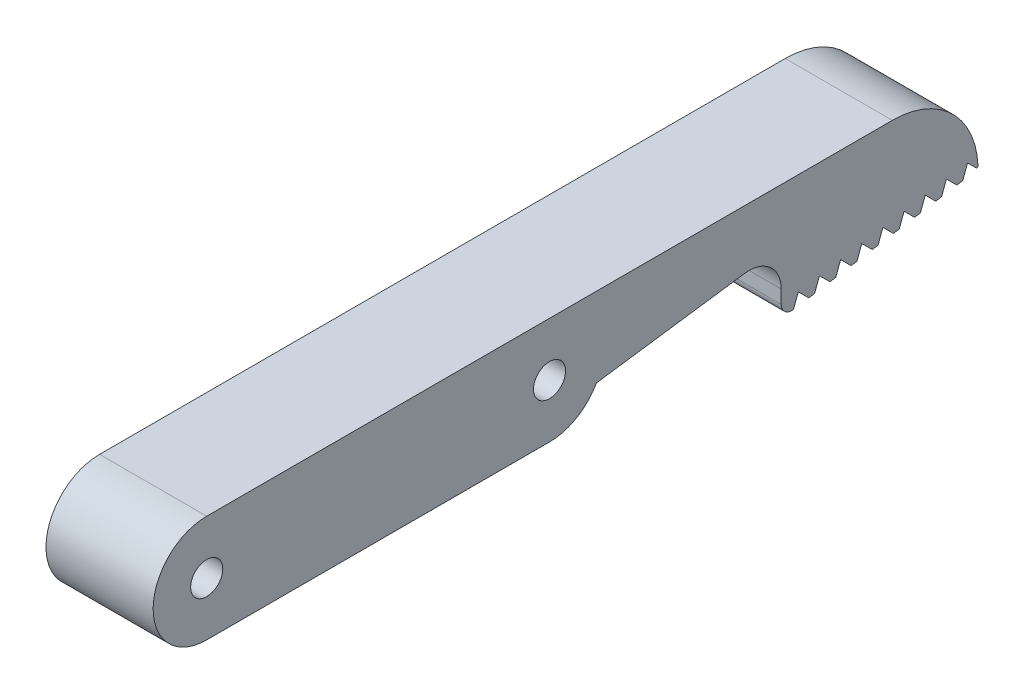
from build123d import *

# Parameters (mm, degrees)
SKETCH1_R           = 5
SKETCH1_R_2         = 1.5
BOSS_EXTRUDE1_DEPTH = 5
BOSS_EXTRUDE4_DEPTH = 10
FILLET5_R           = 3
FILLET7_R           = 8
CUT_EXTRUDE6_DEPTH  = 10
FILLET9_R           = 1
FILLET11_R          = 0.1


with BuildPart() as part:
    # Sketch1 → Boss-Extrude1 (new, symmetric)
    # profile 1 of 3: a face of its own
    with BuildSketch(Plane(origin=(0, 0, 0), x_dir=(0, 0, -1), z_dir=(1, 0, 0))):
        with BuildLine():
            ThreePointArc((-11, 0), (-12.464466094, -3.535533906), (-16, -5))
            Line((-16, -5), (16, -5))
            ThreePointArc((16, -5), (11, 0), (16, 5))
            Line((16, 5), (-16, 5))
            ThreePointArc((-16, 5), (-12.464466094, 3.535533906), (-11, 0))
        make_face()
    # profile 2 of 3: a face of its own
    with BuildSketch(Plane(origin=(0, 0, 0), x_dir=(0, 0, -1), z_dir=(1, 0, 0))):
        with Locations((-16, 0)):
            Circle(SKETCH1_R)
        with Locations((-16, 0)):
            Circle(SKETCH1_R_2, mode=Mode.SUBTRACT)
    # profile 3 of 3: a face of its own
    with BuildSketch(Plane(origin=(0, 0, 0), x_dir=(0, 0, -1), z_dir=(1, 0, 0))):
        with Locations((16, 0)):
            Circle(SKETCH1_R)
        with Locations((16, 0)):
            Circle(SKETCH1_R_2, mode=Mode.SUBTRACT)
    extrude(amount=BOSS_EXTRUDE1_DEPTH, both=True)

    # Sketch6 → Boss-Extrude4 (add)
    with BuildSketch(Plane(origin=(5, 0, 0), x_dir=(0, 0, -1), z_dir=(1, 0, 0))):
        with BuildLine():
            Line((20.375428035, -2.419840804), (37.626356882, 0))
            Line((37.626356882, 0), (37.626356882, -5.863506349))
            Line((37.626356882, -5.863506349), (56, -2.931753174))
            Line((56, -2.931753174), (56, -0.788607304))
            Line((56, -0.788607304), (56, 5))
            Line((56, 5), (16, 5))
            ThreePointArc((16, 5), (20.30692489, 2.539763373), (20.375428035, -2.419840804))
        make_face()
    extrude(amount=-BOSS_EXTRUDE4_DEPTH)

    # Fillet5
    fillet5_edges = [part.edges().sort_by_distance(p)[0] for p in [
        (0, 0, -37.626356882),
    ]]
    fillet(fillet5_edges, radius=FILLET5_R)

    # Fillet7
    # the kernel refuses this fillet: 8 mm, written as the material it takes off along each edge
    with BuildSketch(Plane(origin=(25, 5, -56), x_dir=(0, -1, 0), z_dir=(-1, 0, 0))) as fillet7_piece_1:
        with BuildLine():
            CenterArc((FILLET7_R, FILLET7_R), FILLET7_R, 180, 90)
            Line((0, FILLET7_R), (0, 0))
            Line((0, 0), (FILLET7_R, 0))
        make_face()
    extrude(amount=50, mode=Mode.SUBTRACT)

    # Sketch8 → Cut-Extrude6 (cut)
    with BuildSketch(Plane(origin=(5, 0, 0), x_dir=(0, 0, -1), z_dir=(1, 0, 0))):
        Polygon((56, -2.931753174), (55.020132037, -1.951885211), (54.570397118, -3.159864865), (54.024984262, -3.246892563), (53.045116299, -2.2670246), (52.59538138, -3.475004253), (52.049968524, -3.562031952), (51.070100561, -2.582163988), (50.620365642, -3.790143642), (50.074952786, -3.87717134), (49.095084823, -2.897303377), (48.645349904, -4.10528303), (48.099937048, -4.192310729), (47.120069084, -3.212442766), (46.670334166, -4.420422419), (46.12492131, -4.507450118), (45.145053346, -3.527582154), (44.695318427, -4.735561808), (44.149905571, -4.822589506), (43.170037608, -3.842721543), (42.720302689, -5.050701196), (42.174889833, -5.137728895), (41.19502187, -4.157860932), (40.745286951, -5.365840585), (40.199874095, -5.452868283), (39.220006132, -4.47300032), (38.770271213, -5.680979974), (37.626356882, -5.863506349), (46.12492131, -12.960580579), align=None)
    extrude(amount=-CUT_EXTRUDE6_DEPTH, mode=Mode.SUBTRACT)

    # Fillet9
    # the kernel refuses this fillet: 1 mm, written as the material it takes off along each edge
    with BuildSketch(Plane(origin=(7.930532836, -5.863506349, -37.626356882), x_dir=(0, 0.15756969432487367, -0.9875078690473135), z_dir=(-1, 0, 0))) as fillet9_piece_1:
        with BuildLine():
            CenterArc((FILLET9_R * 1.1722131343, -FILLET9_R), FILLET9_R, 90, 99.065860636)
            Line((FILLET9_R * 0.184705265256, -FILLET9_R * 1.15756969432), (0, 0))
            Line((0, 0), (FILLET9_R * 1.1722131343, 0))
        make_face()
    extrude(amount=15.861065672, mode=Mode.SUBTRACT)

    # Fillet11
    fillet11_edges = [part.edges().sort_by_distance(p)[0] for p in [
        (0, -2.931459557, -55.999706383),
    ]]
    fillet(fillet11_edges, radius=FILLET11_R)


solid = part.part
